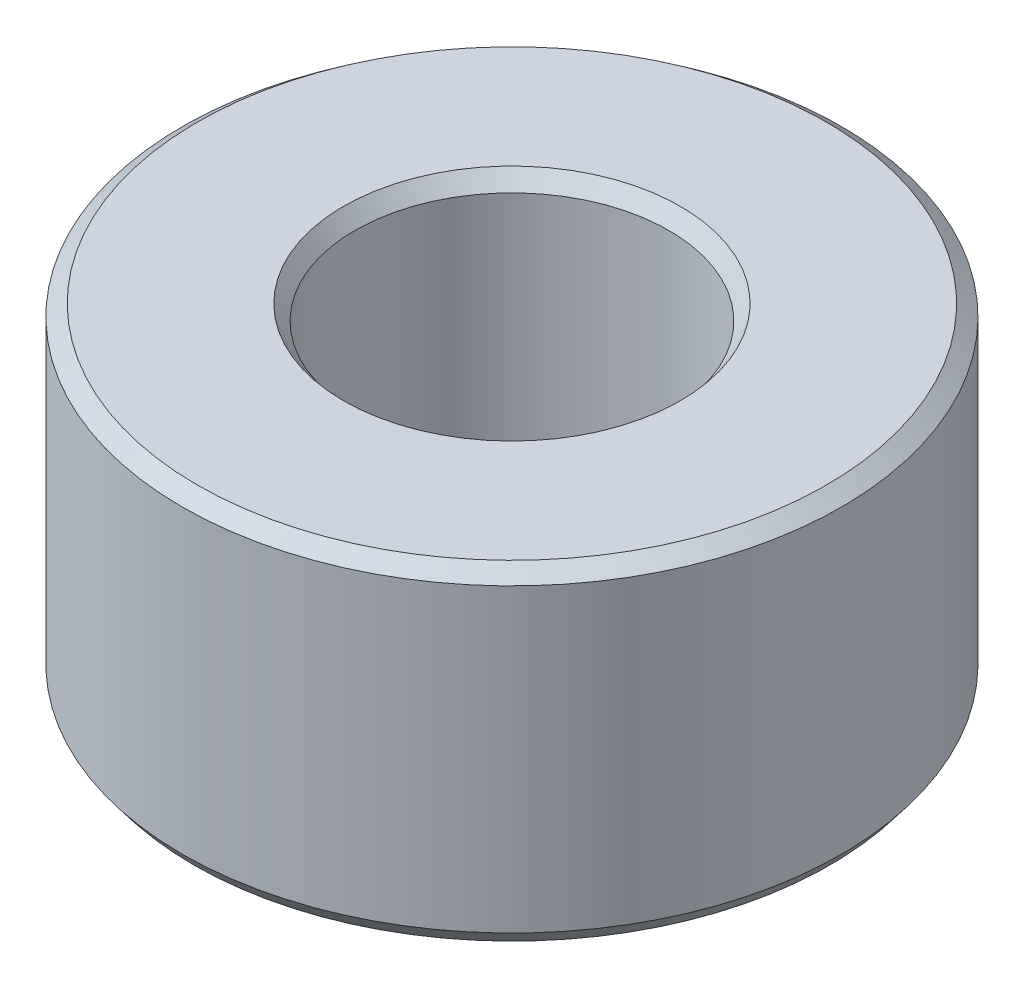
from build123d import *
from OCP.BRepFilletAPI import BRepFilletAPI_MakeChamfer

# Parameters (mm, degrees)
SKETCH1_R           = 57.5
BOSS_EXTRUDE1_DEPTH = 57.096937647
SKETCH2_R           = 27.380579511
CUT_EXTRUDE1_DEPTH  = 100.360758294
CHAMFER1_SIZE       = 2.003984683
CHAMFER1_SIZE2      = 2.635635213


with BuildPart() as part:
    # Sketch1 → Boss-Extrude1 (new body)
    with BuildSketch(Plane(origin=(0, 0, 0), x_dir=(1, 0, 0), z_dir=(0, 1, 0))):
        Circle(SKETCH1_R)
    extrude(amount=BOSS_EXTRUDE1_DEPTH)

    # Sketch2 → Cut-Extrude1 (cut, through all)
    with BuildSketch(Plane(origin=(0, 0, 0), x_dir=(1, 0, 0), z_dir=(0, 1, 0))):
        Circle(SKETCH2_R)
    extrude(amount=CUT_EXTRUDE1_DEPTH, mode=Mode.SUBTRACT)

    # Chamfer1: one chamfer whose edges measure the first distance from different faces: ONE call of the kernel's chamfer builder (chamfer() names one face for all edges)
    chamfer1_edges_1 = [part.edges().sort_by_distance(p)[0] for p in [
        (-27.380579511, 57.096937647, 0),
    ]]
    chamfer1_side_1 = [part.faces().sort_by_distance(p)[0] for p in [
        (-55.873654403, 57.096937647, 0),
    ]]
    chamfer1_edges_2 = [part.edges().sort_by_distance(p)[0] for p in [
        (-27.380579511, 0, 0),
    ]]
    chamfer1_side_2 = [part.faces().sort_by_distance(p)[0] for p in [
        (-27.380579511, 28.548468824, 0),
    ]]
    chamfer1_edges_3 = [part.edges().sort_by_distance(p)[0] for p in [
        (-57.5, 0, 0),
    ]]
    chamfer1_side_3 = [part.faces().sort_by_distance(p)[0] for p in [
        (-55.873654403, 0, 0),
    ]]
    chamfer1_edges_4 = [part.edges().sort_by_distance(p)[0] for p in [
        (-57.5, 57.096937647, 0),
    ]]
    chamfer1_side_4 = [part.faces().sort_by_distance(p)[0] for p in [
        (-57.5, 28.548468824, 0),
    ]]
    chamfer1 = BRepFilletAPI_MakeChamfer(part.part.solid().wrapped)
    for e in chamfer1_edges_1:
        chamfer1.Add(CHAMFER1_SIZE, CHAMFER1_SIZE2, e.wrapped, chamfer1_side_1[0].wrapped)  # the first distance lies on this face
    for e in chamfer1_edges_2:
        chamfer1.Add(CHAMFER1_SIZE, CHAMFER1_SIZE2, e.wrapped, chamfer1_side_2[0].wrapped)  # the first distance lies on this face
    for e in chamfer1_edges_3:
        chamfer1.Add(CHAMFER1_SIZE, CHAMFER1_SIZE2, e.wrapped, chamfer1_side_3[0].wrapped)  # the first distance lies on this face
    for e in chamfer1_edges_4:
        chamfer1.Add(CHAMFER1_SIZE, CHAMFER1_SIZE2, e.wrapped, chamfer1_side_4[0].wrapped)  # the first distance lies on this face
    add(Compound.cast(chamfer1.Shape()), mode=Mode.REPLACE)


solid = part.part
